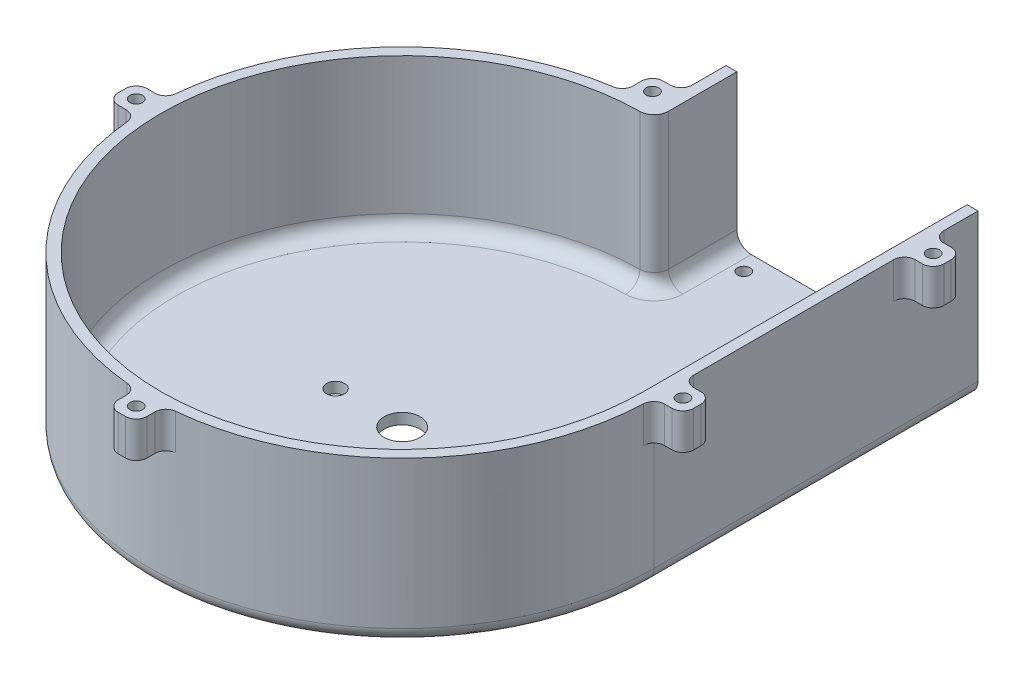
from build123d import *

# Parameters (mm, degrees)
SKETCH2_R           = 2.4999999999999982
SKETCH2_R_2         = 4.999999999999999
BOSS_EXTRUDE1_DEPTH = 3
BOSS_EXTRUDE2_DEPTH = 42
BOSS_EXTRUDE3_START = -10
SKETCH4_R           = 1.7500000000000016
SKETCH4_R_2         = 1.749999999999997
SKETCH4_R_3         = 1.7500000000000113
SKETCH4_W           = 8.000000000000014
SKETCH4_H           = 8
SKETCH4_R_4         = 1.7500000000000013
BOSS_EXTRUDE3_DEPTH = 10
FILLET1_R           = 3
FILLET2_R           = 4
FILLET3_R           = 4
FILLET4_R           = 4
SKETCH5_R           = 1.7500000000000004
SKETCH5_R_2         = 1.7500000000000038
CUT_EXTRUDE1_DEPTH  = 128.31457114957425


with BuildPart() as part:
    # Sketch2 → Boss-Extrude1 (new body)
    with BuildSketch(Plane(origin=(0, 0, 0), x_dir=(1, 0, 0), z_dir=(0, 1, 0))):
        with BuildLine():
            Line((70, 0), (70, 90.00000000000003))
            Line((70, 90.00000000000003), (0, 90.00000000000003))
            Line((0, 90.00000000000003), (0, 70))
            ThreePointArc((0, 70), (-49.497474683058336, -49.49747468305832), (70, 0))
        make_face()
        with Locations(Location((18.5, 0, 0), (0, 0, 270))):
            Circle(SKETCH2_R, mode=Mode.SUBTRACT)
        with Locations(Location((-18.5, 0, 0), (0, 0, 270))):
            Circle(SKETCH2_R, mode=Mode.SUBTRACT)
        with Locations(Location((0, 0, 0), (0, 0, 270))):
            Circle(SKETCH2_R_2, mode=Mode.SUBTRACT)
    extrude(amount=BOSS_EXTRUDE1_DEPTH)

    # Sketch3 → Boss-Extrude2 (add)
    with BuildSketch(Plane(origin=(0, 3, 0), x_dir=(1, 0, 0), z_dir=(0, 1, 0))):
        with BuildLine():
            Line((0, 90.00000000000003), (3.0000000000000027, 90.00000000000003))
            Line((3.0000000000000027, 90.00000000000003), (3, 66.93280212272603))
            ThreePointArc((3, 66.93280212272603), (-48.425200051213004, -46.30334761116088), (67, 8.21e-15))
            Line((67, 8.21e-15), (67, 90.00000000000003))
            Line((67, 90.00000000000003), (70, 90.00000000000003))
            Line((70, 90.00000000000003), (70, 0))
            ThreePointArc((70, 0), (-49.497474683058336, -49.49747468305832), (4.29e-15, 70))
            Line((4.29e-15, 70), (0, 90.00000000000003))
        make_face()
    extrude(amount=BOSS_EXTRUDE2_DEPTH)

    # Sketch4 → Boss-Extrude3 (add)
    # profile 1 of 5: a face of its own
    with BuildSketch(Plane(origin=(0, 45.00000000000001, 0), x_dir=(1, 0, 0), z_dir=(0, 1, 0)).offset(BOSS_EXTRUDE3_START)):
        with BuildLine():
            ThreePointArc((4.000000000000007, -69.88562083862459), (-1.996e-14, -70), (-4.000000000000016, -69.88562083862459))
            Line((-4, -69.88562083862459), (-4, -77.8856208386246))
            Line((-4, -77.8856208386246), (4, -77.8856208386246))
            Line((4, -77.8856208386246), (4, -69.88562083862459))
        make_face()
        with Locations(Location((-1.35e-15, -73.8856208386246, 0), (0, 0, 270))):
            Circle(SKETCH4_R, mode=Mode.SUBTRACT)
    # profile 2 of 5: a face of its own
    with BuildSketch(Plane(origin=(0, 45.00000000000001, 0), x_dir=(1, 0, 0), z_dir=(0, 1, 0)).offset(BOSS_EXTRUDE3_START)):
        with BuildLine():
            ThreePointArc((-69.88562083862459, -3.999999999999999), (-70, -3.42e-15), (-69.88562083862459, 3.999999999999993))
            Line((-69.88562083862459, 3.9999999999999973), (-77.88562083862459, 3.9999999999999964))
            Line((-77.88562083862459, 3.9999999999999964), (-77.8856208386246, -3.9999999999999964))
            Line((-77.8856208386246, -3.9999999999999964), (-69.88562083862459, -3.9999999999999973))
        make_face()
        with Locations(Location((-73.8856208386246, 0, 0), (0, 0, 270))):
            Circle(SKETCH4_R_2, mode=Mode.SUBTRACT)
    # profile 3 of 5: a face of its own
    with BuildSketch(Plane(origin=(0, 45.00000000000001, 0), x_dir=(1, 0, 0), z_dir=(0, 1, 0)).offset(BOSS_EXTRUDE3_START)):
        Polygon((70, 8.000000000000007), (70, 0), (78.00000000000001, 0), (78.00000000000001, 8.000000000000009), align=None)
        with Locations(Location((74.00000000000001, 4.0000000000000036, 0), (0, 0, 270))):
            Circle(SKETCH4_R_3, mode=Mode.SUBTRACT)
    # profile 4 of 5: a face of its own
    with BuildSketch(Plane(origin=(0, 45.00000000000001, 0), x_dir=(1, 0, 0), z_dir=(0, 1, 0)).offset(BOSS_EXTRUDE3_START)):
        with Locations((74, 73.54135460285487)):
            Rectangle(SKETCH4_W, SKETCH4_H)
        with Locations(Location((74.00000000000001, 73.54135460285487, 0), (0, 0, 270))):
            Circle(SKETCH4_R_2, mode=Mode.SUBTRACT)
    # profile 5 of 5: a face of its own
    with BuildSketch(Plane(origin=(0, 45.00000000000001, 0), x_dir=(1, 0, 0), z_dir=(0, 1, 0)).offset(BOSS_EXTRUDE3_START)):
        with BuildLine():
            Line((4.29e-15, 70), (0, 77.54135460285485))
            Line((0, 77.54135460285485), (-8, 77.54135460285485))
            Line((-8, 77.54135460285485), (-8, 69.54135460285485))
            ThreePointArc((-7.999999999999997, 69.54135460285484), (-4.00656821982112, 69.88524458782354), (4.29e-15, 70))
        make_face()
        with Locations(Location((-3.9999999999999956, 73.54135460285485, 0), (0, 0, 270))):
            Circle(SKETCH4_R_4, mode=Mode.SUBTRACT)
    extrude(amount=BOSS_EXTRUDE3_DEPTH)

    # Fillet1
    # the kernel refuses this fillet: 3 mm, written as the material it adds along each edge
    with BuildSketch(Plane(origin=(0, 35.00000000000001, -77.54135460285485), x_dir=(7.4e-16, 0, -1), z_dir=(0, 1, 0))) as fillet1_piece_1:
        with BuildLine():
            CenterArc((FILLET1_R, FILLET1_R), FILLET1_R, 180, 90.00000000000006)
            Line((-2.22e-15, FILLET1_R), (0, 0))
            Line((0, 0), (FILLET1_R, 0))
        make_face()
    extrude(amount=10)
    with BuildSketch(Plane(origin=(-7.999999999999998, 35.00000000000001, -69.54135460285484), x_dir=(-6.8e-16, 0, -1), z_dir=(0, 1, 0))) as fillet1_piece_2:
        with BuildLine():
            CenterArc((2.625119607821278, 3), FILLET1_R, 188.66662141673424, 81.3333785832657)
            ThreePointArc((-0.3406259076859169, 2.547945205479499), (-0.15861593060733895, 1.2755363369787691), (0, 0))
            Line((0, 0), (2.6251196078212757, 0))
        make_face()
    extrude(amount=10)
    with BuildSketch(Plane(origin=(4.0000000000000036, 35.00000000000001, 69.88562083862459), x_dir=(-1.28e-15, 0, 1), z_dir=(0, 1, 0))) as fillet1_piece_3:
        with BuildLine():
            CenterArc((2.7779876597158153, 3), FILLET1_R, 185.5025705800243, 84.49742941997579)
            ThreePointArc((-0.20818803199677297, 2.7123287671232883), (-0.09091711741021587, 1.3571757921409222), (0, 0))
            Line((0, 0), (2.7779876597158193, 0))
        make_face()
    extrude(amount=10)
    with BuildSketch(Plane(origin=(-4.000000000000009, 35.00000000000001, 69.88562083862459), x_dir=(3.2e-15, 0, 1), z_dir=(0, 1, 0))) as fillet1_piece_4:
        with BuildLine():
            CenterArc((2.7779876597149995, -3), FILLET1_R, 89.99999999999982, 84.49742941997455)
            ThreePointArc((-0.20818803199758817, -2.7123287671232172), (-0.09091711741020427, -1.3571757921409284), (0, 0))
            Line((0, 0), (2.7779876597150093, 0))
        make_face()
    extrude(amount=10)
    with BuildSketch(Plane(origin=(-69.88562083862459, 35.00000000000001, -3.9999999999999956), x_dir=(-1, 0, -3.2e-16), z_dir=(0, 1, 0))) as fillet1_piece_5:
        with BuildLine():
            CenterArc((2.7779876597150244, -3), FILLET1_R, 90.00000000000003, 84.49742941997454)
            ThreePointArc((-0.20818803199756444, -2.7123287671232275), (-0.09091711741017107, -1.357175792140909), (0, 0))
            Line((0, 0), (2.7779876597150235, 0))
        make_face()
    extrude(amount=10)
    with BuildSketch(Plane(origin=(-69.88562083862459, 35.00000000000001, 3.9999999999999982), x_dir=(-1, 0, -6.4e-16), z_dir=(0, 1, 0))) as fillet1_piece_6:
        with BuildLine():
            CenterArc((2.7779876597158317, 3), FILLET1_R, 185.50257058002416, 84.4974294199759)
            ThreePointArc((-0.208188031996757, 2.712328767123294), (-0.09091711741018658, 1.3571757921409286), (0, 0))
            Line((0, 0), (2.7779876597158335, 0))
        make_face()
    extrude(amount=10)
    with BuildSketch(Plane(origin=(70, 35.00000000000001, -8.000000000000007), x_dir=(0, 0, -1), z_dir=(0, 1, 0))) as fillet1_piece_7:
        with BuildLine():
            CenterArc((FILLET1_R, -FILLET1_R), FILLET1_R, 90, 90)
            Line((0, -FILLET1_R), (0, 0))
            Line((0, 0), (FILLET1_R, 0))
        make_face()
    extrude(amount=10)
    with BuildSketch(Plane(origin=(70, 35.00000000000001, 0), x_dir=(1, 0, 0), z_dir=(0, 1, 0))) as fillet1_piece_8:
        with BuildLine():
            CenterArc((2.9383301152417545, -3), FILLET1_R, 90, 87.64471564422539)
            ThreePointArc((-0.05913550593257355, -2.8767123287671126), (-0.0147854379772383, -1.4386600389375006), (0, 0))
            Line((0, 0), (2.9383301152417545, 0))
        make_face()
    extrude(amount=9.999999999999993)
    with BuildSketch(Plane(origin=(70, 35.00000000000001, -69.54135460285487), x_dir=(0, 0, 1), z_dir=(0, 1, 0))) as fillet1_piece_9:
        with BuildLine():
            CenterArc((FILLET1_R, FILLET1_R), FILLET1_R, 180, 90)
            Line((0, FILLET1_R), (0, 0))
            Line((0, 0), (FILLET1_R, 0))
        make_face()
    extrude(amount=10)
    with BuildSketch(Plane(origin=(70, 35.00000000000001, -77.54135460285487), x_dir=(0, 0, -1), z_dir=(0, 1, 0))) as fillet1_piece_10:
        with BuildLine():
            CenterArc((FILLET1_R, -FILLET1_R), FILLET1_R, 90, 90)
            Line((0, -FILLET1_R), (0, 0))
            Line((0, 0), (FILLET1_R, 0))
        make_face()
    extrude(amount=10)
    # the kernel refuses this fillet: 3 mm, written as the material it takes off along each edge
    with BuildSketch(Plane(origin=(-8, 27.500000000000007, -77.54135460285485), x_dir=(0, 0, 1), z_dir=(0, 1, 0))) as fillet1_2_piece_1:
        with BuildLine():
            CenterArc((FILLET1_R, FILLET1_R), FILLET1_R, 180, 90)
            Line((0, FILLET1_R), (0, 0))
            Line((0, 0), (FILLET1_R, 0))
        make_face()
    extrude(amount=25, mode=Mode.SUBTRACT)
    with BuildSketch(Plane(origin=(4, 27.500000000000007, 77.8856208386246), x_dir=(-1, 0, 0), z_dir=(0, 1, 0))) as fillet1_2_piece_2:
        with BuildLine():
            CenterArc((FILLET1_R, -FILLET1_R), FILLET1_R, 90, 90)
            Line((0, -FILLET1_R), (0, 0))
            Line((0, 0), (FILLET1_R, 0))
        make_face()
    extrude(amount=25, mode=Mode.SUBTRACT)
    with BuildSketch(Plane(origin=(-4, 27.500000000000007, 77.8856208386246), x_dir=(0, 0, -1), z_dir=(0, 1, 0)), Plane(origin=(78.00000000000001, 27.500000000000007, 0), x_dir=(-1, 0, 0), z_dir=(0, 1, 0))) as fillet1_2_piece_3:
        with BuildLine():
            CenterArc((FILLET1_R, -FILLET1_R), FILLET1_R, 90, 90)
            Line((0, -FILLET1_R), (0, 0))
            Line((0, 0), (FILLET1_R, 0))
        make_face()
    extrude(amount=25, mode=Mode.SUBTRACT)
    with BuildSketch(Plane(origin=(-77.88562083862459, 27.500000000000007, -3.9999999999999964), x_dir=(1, 0, -1.5e-16), z_dir=(0, 1, 0))) as fillet1_2_piece_4:
        with BuildLine():
            CenterArc((FILLET1_R, -FILLET1_R), FILLET1_R, 90, 89.99999999999989)
            Line((-4.4e-16, -FILLET1_R), (0, 0))
            Line((0, 0), (FILLET1_R, 0))
        make_face()
    extrude(amount=25, mode=Mode.SUBTRACT)
    with BuildSketch(Plane(origin=(-77.8856208386246, 27.499999999999993, 3.9999999999999964), x_dir=(0, 0, -1), z_dir=(0, 1, 0))) as fillet1_2_piece_5:
        with BuildLine():
            CenterArc((FILLET1_R, -FILLET1_R), FILLET1_R, 89.9999999999999, 90.0000000000001)
            Line((0, -FILLET1_R), (0, 0))
            Line((0, 0), (FILLET1_R, 0))
        make_face()
    extrude(amount=25.00000000000003, mode=Mode.SUBTRACT)
    with BuildSketch(Plane(origin=(78.00000000000001, 27.500000000000007, -8.000000000000009), x_dir=(0, 0, 1), z_dir=(0, 1, 0))) as fillet1_2_piece_6:
        with BuildLine():
            CenterArc((FILLET1_R, -FILLET1_R), FILLET1_R, 90, 90)
            Line((1.78e-15, -FILLET1_R), (0, 0))
            Line((0, 0), (FILLET1_R, 0))
        make_face()
    extrude(amount=25.000000000000007, mode=Mode.SUBTRACT)
    with BuildSketch(Plane(origin=(78.00000000000001, 27.500000000000007, -77.54135460285487), x_dir=(-1, 0, 0), z_dir=(0, 1, 0)), Plane(origin=(78.00000000000001, 27.500000000000007, -69.54135460285487), x_dir=(0, 0, -1), z_dir=(0, 1, 0))) as fillet1_2_piece_7:
        with BuildLine():
            CenterArc((FILLET1_R, FILLET1_R), FILLET1_R, 180, 90)
            Line((0, FILLET1_R), (0, 0))
            Line((0, 0), (FILLET1_R, 0))
        make_face()
    extrude(amount=25, mode=Mode.SUBTRACT)

    # Fillet2
    fillet2_edges = [part.edges().sort_by_distance(p)[0] for p in [
        (3, 24, -66.93280212272603),
    ]]
    fillet(fillet2_edges, radius=FILLET2_R)

    # Fillet3
    fillet3_edges = [part.edges().sort_by_distance(p)[0] for p in [
        (67, 3, -45.000000000000014),
        (-47.04133633246041, 3, 47.70862265939291),
        (3.0000000000000018, 3, -80.4964786985977),
        (1.8482759796652433, 3, -68.18451940719774),
    ]]
    fillet(fillet3_edges, radius=FILLET3_R)

    # Fillet4
    fillet4_edges = [part.edges().sort_by_distance(p)[0] for p in [
        (0, 0, -80.00000000000001),
        (70, 0, -45.000000000000014),
        (-49.49747468305836, 0, 49.4974746830583),
        (-2.95e-15, 19.000000000000004, -70),
    ]]
    fillet(fillet4_edges, radius=FILLET4_R)

    # Sketch5 → Cut-Extrude1 (cut, through all)
    with BuildSketch(Plane.XZ):
        with Locations(Location((10, -84.93000000000002, 0), (0, 0, 270))):
            Circle(SKETCH5_R)
        with Locations(Location((60.00000000000001, -84.93000000000002, 0), (0, 0, 270))):
            Circle(SKETCH5_R_2)
    extrude(amount=-CUT_EXTRUDE1_DEPTH, mode=Mode.SUBTRACT)


solid = part.part
